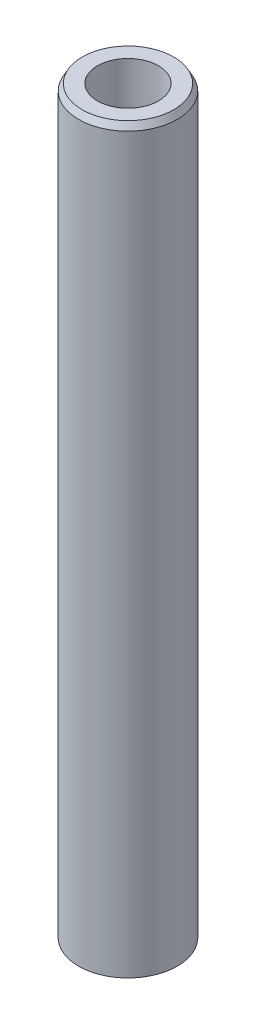
from build123d import *
from OCP.BRepFilletAPI import BRepFilletAPI_MakeChamfer

# Parameters (mm, degrees)
SKETCH1_R           = 27.5
BOSS_EXTRUDE1_DEPTH = 414.265991955
SKETCH2_R           = 16.999673268
CUT_EXTRUDE1_DEPTH  = 417.087505329
CHAMFER1_SIZE       = 3.650820121
CHAMFER1_SIZE2      = 2.012947659


with BuildPart() as part:
    # Sketch1 → Boss-Extrude1 (new body)
    with BuildSketch(Plane(origin=(0, 0, 0), x_dir=(1, 0, 0), z_dir=(0, 1, 0))):
        Circle(SKETCH1_R)
    extrude(amount=BOSS_EXTRUDE1_DEPTH)

    # Sketch2 → Cut-Extrude1 (cut, through all)
    with BuildSketch(Plane(origin=(0, 0, 0), x_dir=(1, 0, 0), z_dir=(0, 1, 0))):
        Circle(SKETCH2_R)
    extrude(amount=CUT_EXTRUDE1_DEPTH, mode=Mode.SUBTRACT)

    # Chamfer1: one chamfer whose edges measure the first distance from different faces: ONE call of the kernel's chamfer builder (chamfer() names one face for all edges)
    chamfer1_edges_1 = [part.edges().sort_by_distance(p)[0] for p in [
        (-27.5, 414.265991955, 0),
    ]]
    chamfer1_side_1 = [part.faces().sort_by_distance(p)[0] for p in [
        (-27.5, 207.132995978, 0),
    ]]
    chamfer1_edges_2 = [part.edges().sort_by_distance(p)[0] for p in [
        (-27.5, 0, 0),
    ]]
    chamfer1_side_2 = [part.faces().sort_by_distance(p)[0] for p in [
        (-26.722182541, 0, 0),
    ]]
    chamfer1 = BRepFilletAPI_MakeChamfer(part.part.solid().wrapped)
    for e in chamfer1_edges_1:
        chamfer1.Add(CHAMFER1_SIZE, CHAMFER1_SIZE2, e.wrapped, chamfer1_side_1[0].wrapped)  # the first distance lies on this face
    for e in chamfer1_edges_2:
        chamfer1.Add(CHAMFER1_SIZE, CHAMFER1_SIZE2, e.wrapped, chamfer1_side_2[0].wrapped)  # the first distance lies on this face
    add(Compound.cast(chamfer1.Shape()), mode=Mode.REPLACE)


solid = part.part
